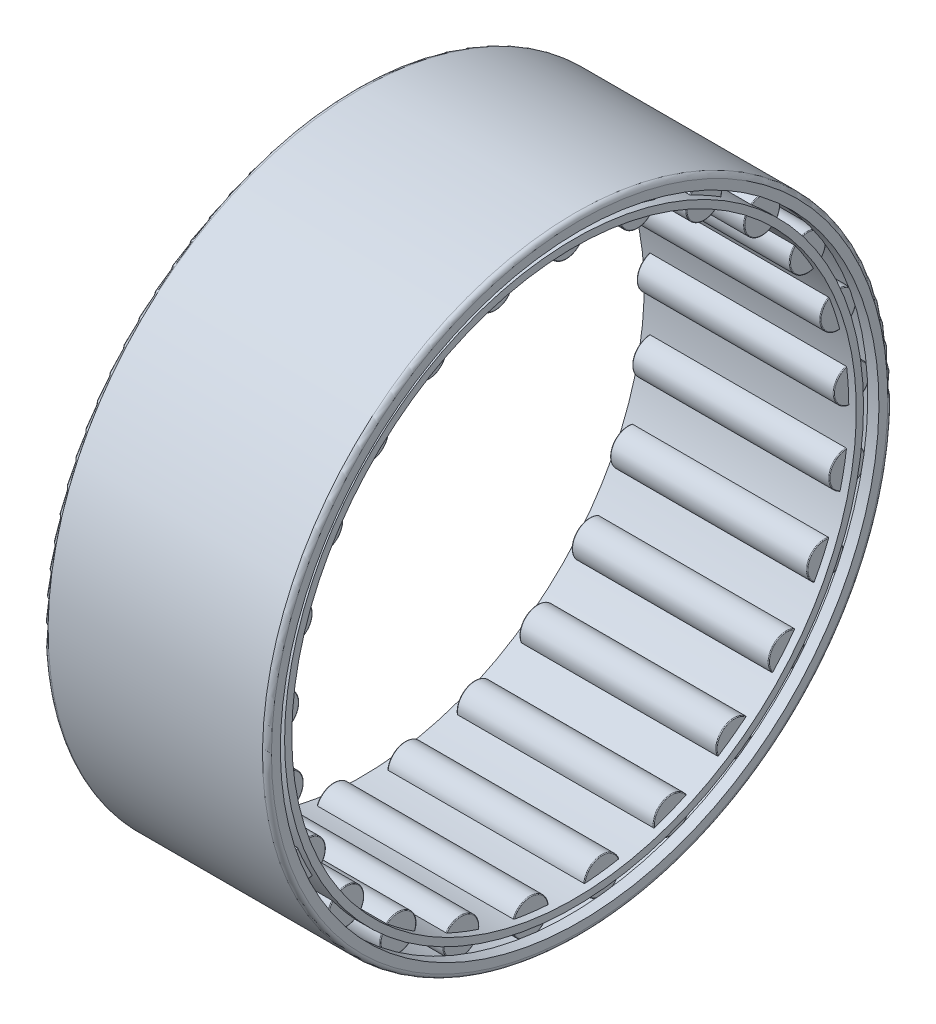
from build123d import *

# Parameters (mm, degrees)
CAGSPISKE_W           = 30.1625
CAGSPISKE_H           = 1.02108
ROLLERSDETAILED_COUNT = 25
ROLLERSDETAILED_ANGLE = 345.6


with BuildPart() as part:
    # InnRacSke → Race (revolve)
    with BuildSketch(Plane.XY):
        with BuildLine():
            Line((-14.2875, 42.545), (-15.875, 42.545))
            Line((-15.875, 42.545), (-15.875, 43.815))
            ThreePointArc((-15.875, 43.815), (-15.689012806, 44.264012806), (-15.24, 44.45))
            Line((-15.24, 44.45), (15.24, 44.45))
            ThreePointArc((15.24, 44.45), (15.689012806, 44.264012806), (15.875, 43.815))
            Line((15.875, 43.815), (15.875, 42.545))
            Line((15.875, 42.545), (14.2875, 42.545))
            Line((14.2875, 42.545), (14.2875, 43.18))
            Line((14.2875, 43.18), (-14.2875, 43.18))
            Line((-14.2875, 43.18), (-14.2875, 42.545))
        make_face()
    revolve(axis=Axis((-31.75, 0, 0), (1, 0, 0)))

    # RolDetSke → RollerDetailed (revolve)
    with BuildSketch(Plane.XY):
        with BuildLine():
            Line((-14.00175, 43.090592), (-14.00175, 40.64))
            Line((-14.00175, 40.64), (14.00175, 40.64))
            Line((14.00175, 40.64), (14.00175, 43.090592))
            ThreePointArc((14.00175, 43.090592), (13.971843259, 43.162793259), (13.899642, 43.1927))
            Line((13.899642, 43.1927), (-13.899642, 43.1927))
            ThreePointArc((-13.899642, 43.1927), (-13.971843259, 43.162793259), (-14.00175, 43.090592))
        make_face()
    rollerdetailed = revolve(axis=Axis((-28.575, 40.64, 0), (1, 0, 0)))

    # CagSpiSke → CageSpine (revolve)
    with BuildSketch(Plane.XY):
        with Locations((0, 40.64)):
            Rectangle(CAGSPISKE_W, CAGSPISKE_H)
    revolve(axis=Axis((-31.75, 0, 0), (1, 0, 0)))

    # RollersDetailed: RollerDetailed ×25 about axis
    rollersdetailed_axis = Axis((-50, 0, 0), (1, 0, 0))
    for i in range(1, ROLLERSDETAILED_COUNT):
        add(rollerdetailed.rotate(rollersdetailed_axis, i * ROLLERSDETAILED_ANGLE / (ROLLERSDETAILED_COUNT - 1)))


solid = part.part
